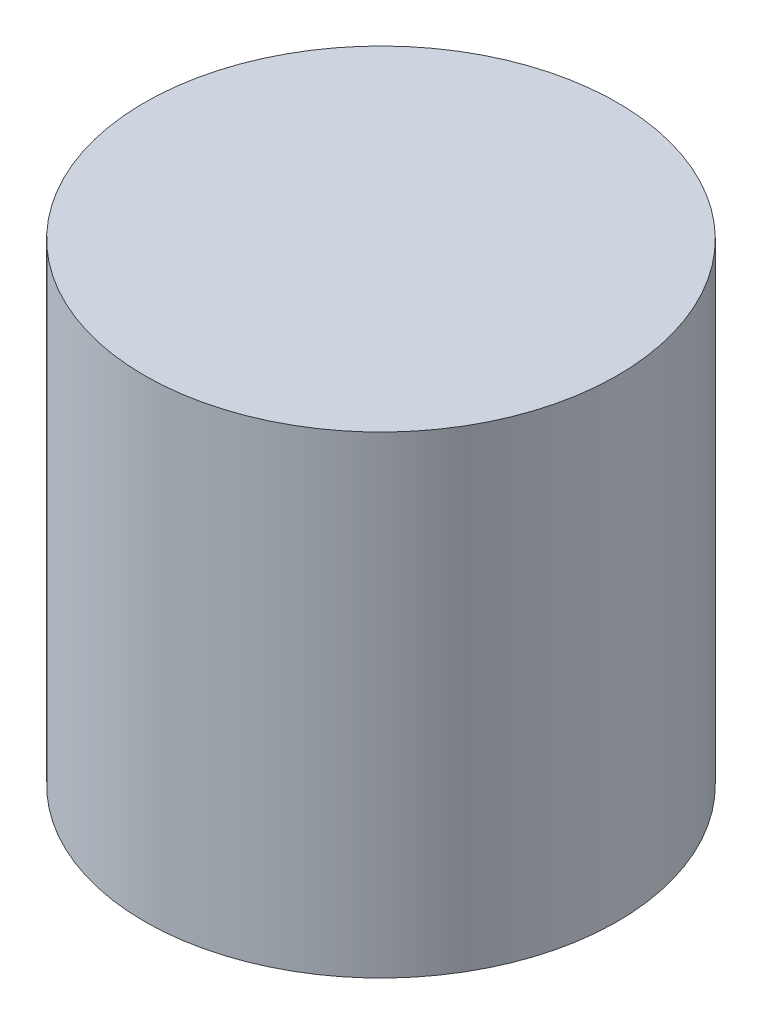
from build123d import *

# Parameters (mm, degrees)
SKETCH1_R           = 3.1242
BOSS_EXTRUDE1_DEPTH = 6.2484


with BuildPart() as part:
    # Sketch1 → Boss-Extrude1 (new body)
    with BuildSketch(Plane(origin=(0, 0, 0), x_dir=(1, 0, 0), z_dir=(0, 1, 0))):
        Circle(SKETCH1_R)
    extrude(amount=BOSS_EXTRUDE1_DEPTH)


solid = part.part
